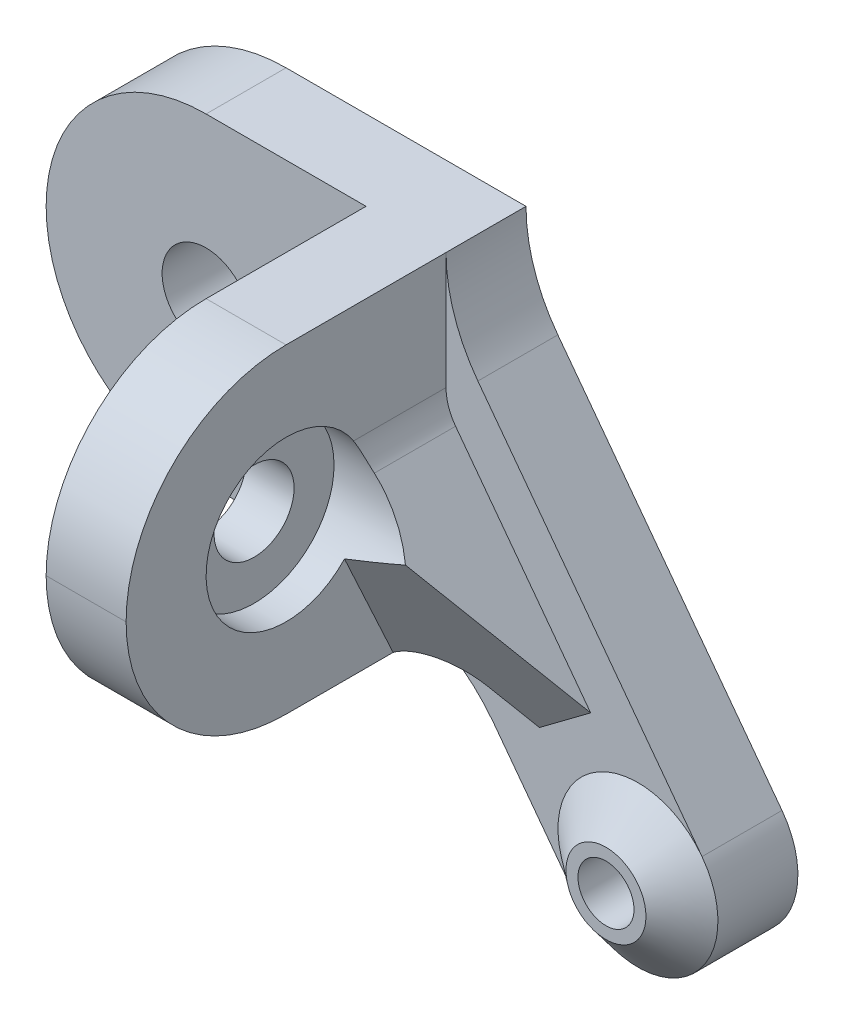
from build123d import *

# Parameters (mm, degrees)
BOSS_EXTRUDE1_DEPTH      = 32.7
SKETCH2_R                = 2.75
CUT_EXTRUDE1_DEPTH       = 10
SKETCH3_R                = 2.75
CUT_EXTRUDE2_DEPTH       = 10
SKETCH4_R                = 5.5
CUT_EXTRUDE3_DEPTH       = 1
SKETCH5_R                = 5.5
CUT_EXTRUDE4_DEPTH       = 1
SKETCH6_R                = 1.75
CUT_EXTRUDE5_DEPTH       = 12
SKETCH7_R                = 2.5
SKETCH7_R_2              = 1.75
BOSS_EXTRUDE2_DEPTH      = 2
CHAMFER2_SIZE2           = 2
CHAMFER2_SIZE            = 2.5
SKETCH9_W                = 5
SKETCH9_H                = 32.7
BOSS_EXTRUDE3_DEPTH      = 20
CUT_EXTRUDE7_DEPTH       = 61.648907657
CUT_EXTRUDE7_DEPTH_BACK  = 61.648907657
BOSS_EXTRUDE4_DEPTH      = 2
BOSS_EXTRUDE4_DEPTH_BACK = 2
CUT_EXTRUDE8_DEPTH       = 22
CUT_EXTRUDE8_DEPTH_BACK  = 2
SKETCH12_R               = 5
SKETCH13_R               = 2.5
CUT_EXTRUDE9_DEPTH       = 12
FILLET2_R                = 10
FILLET3_R                = 3


# Some blends are built 0.0001 mm under size
with BuildPart() as part:
    # Sketch1 → Boss-Extrude1 (new body)
    with BuildSketch(Plane(origin=(0, 0, 0), x_dir=(1, 0, 0), z_dir=(0, 1, 0))):
        Polygon((0, 0), (0, -25), (5, -25), (5, -5), (47, -5), (47, 0), align=None)
    extrude(amount=BOSS_EXTRUDE1_DEPTH)

    # Sketch2 → Cut-Extrude1 (cut)
    with BuildSketch(Plane(origin=(5, 0, 0), x_dir=(0, 0, -1), z_dir=(1, 0, 0))):
        with Locations((-15, 22.7)):
            Circle(SKETCH2_R)
    extrude(amount=-CUT_EXTRUDE1_DEPTH, mode=Mode.SUBTRACT)

    # Sketch3 → Cut-Extrude2 (cut)
    with BuildSketch(Plane.XY.offset(5)):
        with Locations((15, 22.7)):
            Circle(SKETCH3_R)
    extrude(amount=-CUT_EXTRUDE2_DEPTH, mode=Mode.SUBTRACT)

    # Sketch4 → Cut-Extrude3 (cut)
    with BuildSketch(Plane(origin=(0, 0, 0), x_dir=(0, 0, -1), z_dir=(1, 0, 0))):
        with Locations((-15, 22.7)):
            Circle(SKETCH4_R)
    extrude(amount=CUT_EXTRUDE3_DEPTH, mode=Mode.SUBTRACT)

    # Sketch5 → Cut-Extrude4 (cut)
    with BuildSketch(Plane(origin=(0, 0, 0), x_dir=(-1, 0, 0), z_dir=(0, 0, -1))):
        with Locations((-15, 22.7)):
            Circle(SKETCH5_R)
    extrude(amount=-CUT_EXTRUDE4_DEPTH, mode=Mode.SUBTRACT)

    # Sketch6 → Cut-Extrude5 (cut)
    with BuildSketch(Plane(origin=(0, 0, 0), x_dir=(-1, 0, 0), z_dir=(0, 0, -1))):
        with Locations((-42, 5)):
            Circle(SKETCH6_R)
    extrude(amount=-CUT_EXTRUDE5_DEPTH, mode=Mode.SUBTRACT)

    # Sketch7 → Boss-Extrude2 (add)
    with BuildSketch(Plane.XY.offset(5)):
        with Locations(Location((42, 5, 0), (0, 0, 180))):
            Circle(SKETCH7_R)
        with Locations(Location((42, 5, 0), (0, 0, 180))):
            Circle(SKETCH7_R_2, mode=Mode.SUBTRACT)
    extrude(amount=BOSS_EXTRUDE2_DEPTH)

    # Chamfer2
    chamfer2_edges = [part.edges().sort_by_distance(p)[0] for p in [
        (44.5, 5, 5),
    ]]
    chamfer2_side = [part.faces().sort_by_distance(p)[0] for p in [
        (44.54, 5, 5),
    ]]
    chamfer(chamfer2_edges, length=CHAMFER2_SIZE - 0.0001, length2=CHAMFER2_SIZE2 - 0.0001, reference=chamfer2_side[0])  # a hair under: the kernel refuses the full size

    # Sketch9 → Boss-Extrude3 (add)
    with BuildSketch(Plane.XY.offset(5)):
        with Locations((27.5, 16.35)):
            Rectangle(SKETCH9_W, SKETCH9_H)
    extrude(amount=BOSS_EXTRUDE3_DEPTH)

    # Sketch10 → Cut-Extrude7 (cut, two sides: drawn at the far end of the back side and taken through both)
    with BuildSketch(Plane.XY.offset(5).offset(-CUT_EXTRUDE7_DEPTH_BACK)):
        with BuildLine():
            Line((5, 12.7), (30, 12.7))
            Line((30, 12.7), (37.995512213, 2.005993059))
            ThreePointArc((37.995512213, 2.005993059), (44.994006941, 0.995512213), (46.004487787, 7.994006941))
            Line((46.004487787, 7.994006941), (30, 29.400028085))
            Line((30, 29.400028085), (30, 32.7))
            Line((30, 32.7), (49.686472609, 32.7))
            Line((49.686472609, 32.7), (49.686472609, -0.881235219))
            Line((49.686472609, -0.881235219), (0, -0.881235219))
            Line((0, -0.881235219), (0, 12.7))
            Line((0, 12.7), (0, 32.7))
            Line((0, 32.7), (5, 32.7))
            Line((5, 32.7), (5, 12.7))
        make_face()
    extrude(amount=CUT_EXTRUDE7_DEPTH + CUT_EXTRUDE7_DEPTH_BACK, mode=Mode.SUBTRACT)

    # Sketch11 → Boss-Extrude4 (add, two sides: drawn at the far end of the back side and taken through both)
    with BuildSketch(Plane(origin=(29.338242541, 21.935115419, 0), x_dir=(0, 0, -1), z_dir=(0.8008975574269149, 0.5988013881977909, 0)).offset(-BOSS_EXTRUDE4_DEPTH_BACK)):
        Polygon((-3.987748306, -15.286856853), (-15.005027819, 3.825227861), (-3.987748306, 3.825227861), align=None)
    extrude(amount=BOSS_EXTRUDE4_DEPTH + BOSS_EXTRUDE4_DEPTH_BACK)

    # Sketch12 → Cut-Extrude8 (cut, two sides: drawn at the far end of the back side and taken through both)
    with BuildSketch(Plane(origin=(30, 0, 0), x_dir=(0, 0, -1), z_dir=(1, 0, 0)).offset(-CUT_EXTRUDE8_DEPTH_BACK)):
        with Locations(Location((-15, 22.7, 0), (0, 0, 316.92030417))):
            Circle(SKETCH12_R)
    extrude(amount=CUT_EXTRUDE8_DEPTH + CUT_EXTRUDE8_DEPTH_BACK, mode=Mode.SUBTRACT)

    # Sketch13 → Cut-Extrude9 (cut)
    with BuildSketch(Plane(origin=(28, 0, 0), x_dir=(0, 0, -1), z_dir=(1, 0, 0))):
        with Locations((-15, 22.7)):
            Circle(SKETCH13_R)
    extrude(amount=-CUT_EXTRUDE9_DEPTH, mode=Mode.SUBTRACT)

    # Fillet2
    # the kernel refuses this fillet: 10 mm, written as the material it adds along each edge
    with BuildSketch(Plane(origin=(30, 12.7, 5), x_dir=(-1, 0, 0), z_dir=(0, 0, -1))) as fillet2_piece_1:
        with BuildLine():
            CenterArc((FILLET2_R * 0.500936240948, -FILLET2_R), FILLET2_R, 90, 53.215898456)
            Line((-FILLET2_R * 0.299961316478, -FILLET2_R * 0.401198611802), (0, 0))
            Line((0, 0), (FILLET2_R * 0.500936240948, 0))
        make_face()
    extrude(amount=5)
    with BuildSketch(Plane(origin=(30, 29.400028085, 5), x_dir=(0, 1, 0), z_dir=(0, 0, -1))) as fillet2_piece_2_section:
        with BuildLine():
            CenterArc((FILLET2_R * 0.332501638268, FILLET2_R), FILLET2_R, 233.215898456, 36.784101544)
            Line((-FILLET2_R * 0.26629974993, FILLET2_R * 0.199102442573), (0, 0))
            Line((0, 0), (FILLET2_R * 0.332501638268, 0))
        make_face()
    fillet2_piece_2 = extrude(amount=5, mode=Mode.PRIVATE)
    fillet2_piece_2 = split(fillet2_piece_2, bisect_by=Plane(origin=(30.405353405, 32.7, 2.5), z_dir=(0, -1, 0)), keep=Keep.TOP, mode=Mode.PRIVATE)
    add(fillet2_piece_2)
    # the kernel refuses this fillet: 10 mm, written as the material it takes off along each edge
    with BuildSketch(Plane(origin=(5, 32.7, -25), x_dir=(1, 0, 0), z_dir=(0, 0, 1)), Plane(origin=(5, 12.7, -25), x_dir=(0, 1, 0), z_dir=(0, 0, 1)), Plane(origin=(55, 32.7, 25), x_dir=(0, -1, 0), z_dir=(-1, 0, 0))) as fillet2_2_piece_1:
        with BuildLine():
            CenterArc((FILLET2_R, -FILLET2_R), FILLET2_R, 90, 90)
            Line((0, -FILLET2_R), (0, 0))
            Line((0, 0), (FILLET2_R, 0))
        make_face()
    extrude(amount=55, mode=Mode.SUBTRACT)
    with BuildSketch(Plane(origin=(55, 12.7, 25), x_dir=(0, 1, 0), z_dir=(-1, 0, 0))) as fillet2_2_piece_2:
        with BuildLine():
            CenterArc((FILLET2_R, FILLET2_R), FILLET2_R, 180, 90)
            Line((0, FILLET2_R), (0, 0))
            Line((0, 0), (FILLET2_R, 0))
        make_face()
    extrude(amount=55, mode=Mode.SUBTRACT)

    # Fillet3
    # the kernel refuses this fillet: 3 mm, written as the material it adds along each edge
    with BuildSketch(Plane(origin=(30, 17.710008425, 5), x_dir=(0, -1, 0), z_dir=(0, 0, 1))) as fillet3_piece_1_section:
        with BuildLine():
            CenterArc((7.412701098, 1.796404165), FILLET3_R, 126.784101544, 90)
            Line((5.616296933, 4.199096837), (0, 0))
            Line((0, 0), (5.010008425, 0))
        make_face()
    fillet3_piece_1 = extrude(amount=23.152125711, mode=Mode.PRIVATE)
    fillet3_piece_1 = split(fillet3_piece_1, bisect_by=Plane(origin=(32.136421782, 12.848533367, 7.638953708), z_dir=(-0.29905275482083415, 0.39998340952189465, -0.8663606188772148)), keep=Keep.TOP, mode=Mode.PRIVATE)
    add(fillet3_piece_1)
    with BuildSketch(Plane(origin=(30, 24.390019659, 2.506237713), x_dir=(0, 1, 0), z_dir=(0, 0, 1))) as fillet3_piece_2_section:
        with BuildLine():
            CenterArc((FILLET3_R * 0.332501638268, -FILLET3_R), FILLET3_R, 90, 36.784101544)
            Line((-FILLET3_R * 0.26629974993, -FILLET3_R * 0.199102442573), (0, 0))
            Line((0, 0), (FILLET3_R * 0.332501638268, 0))
        make_face()
    fillet3_piece_2 = extrude(amount=10.281801085, mode=Mode.PRIVATE)
    fillet3_piece_2 = fillet3_piece_2 - Plane(origin=(30.119829387, 22.7, 15), x_dir=(0, -0.6830149798048508, -0.7304043656510956), z_dir=(1, 0, 0)) * Cylinder(5, 25, mode=Mode.PRIVATE)
    add(fillet3_piece_2)


solid = part.part
